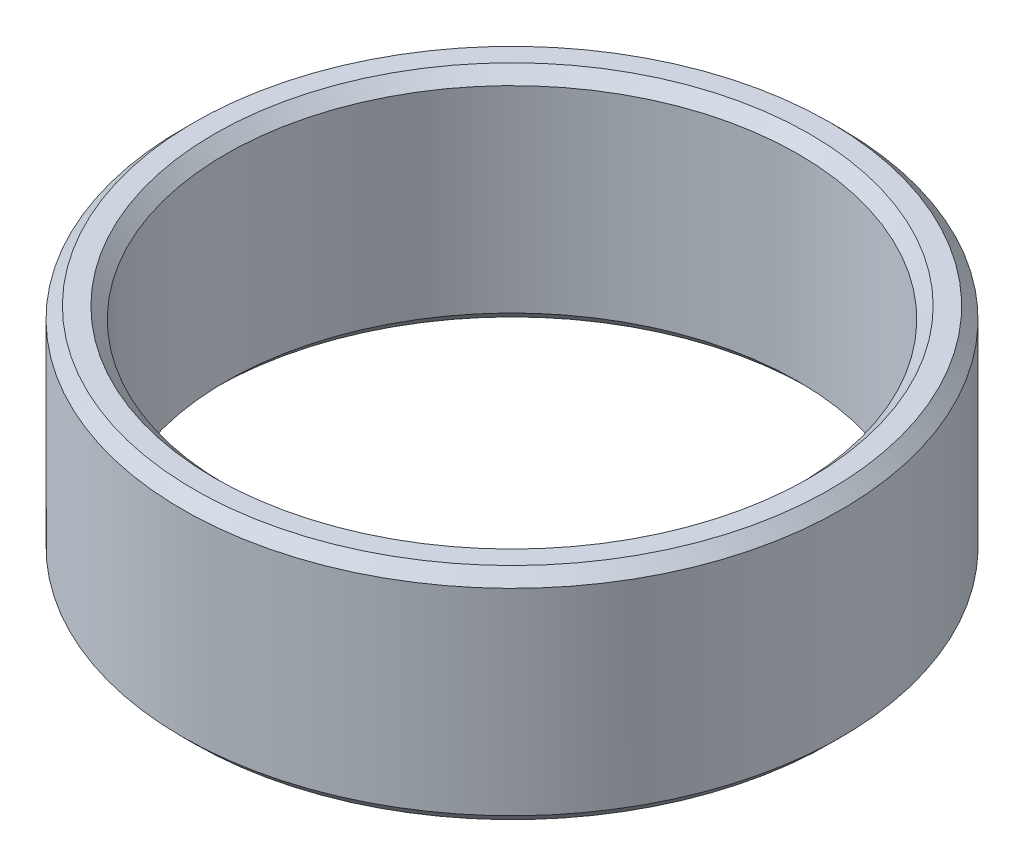
from build123d import *

# Parameters (mm, degrees)
SKETCH1_R           = 42.5
BOSS_EXTRUDE1_DEPTH = 28.384178063
SKETCH2_R           = 36.912914299
CUT_EXTRUDE1_DEPTH  = 67.469252774
CHAMFER1_SIZE       = 1.494264716


with BuildPart() as part:
    # Sketch1 → Boss-Extrude1 (new body)
    with BuildSketch(Plane(origin=(0, 0, 0), x_dir=(1, 0, 0), z_dir=(0, 1, 0))):
        Circle(SKETCH1_R)
    extrude(amount=BOSS_EXTRUDE1_DEPTH)

    # Sketch2 → Cut-Extrude1 (cut, through all)
    with BuildSketch(Plane(origin=(0, 0, 0), x_dir=(1, 0, 0), z_dir=(0, 1, 0))):
        Circle(SKETCH2_R)
    extrude(amount=CUT_EXTRUDE1_DEPTH, mode=Mode.SUBTRACT)

    # Chamfer1
    chamfer1_edges = [part.edges().sort_by_distance(p)[0] for p in [
        (-36.912914299, 28.384178063, 0),
        (-36.912914299, 0, 0),
        (-42.5, 0, 0),
        (-42.5, 28.384178063, 0),
    ]]
    chamfer(chamfer1_edges, length=CHAMFER1_SIZE)


solid = part.part
